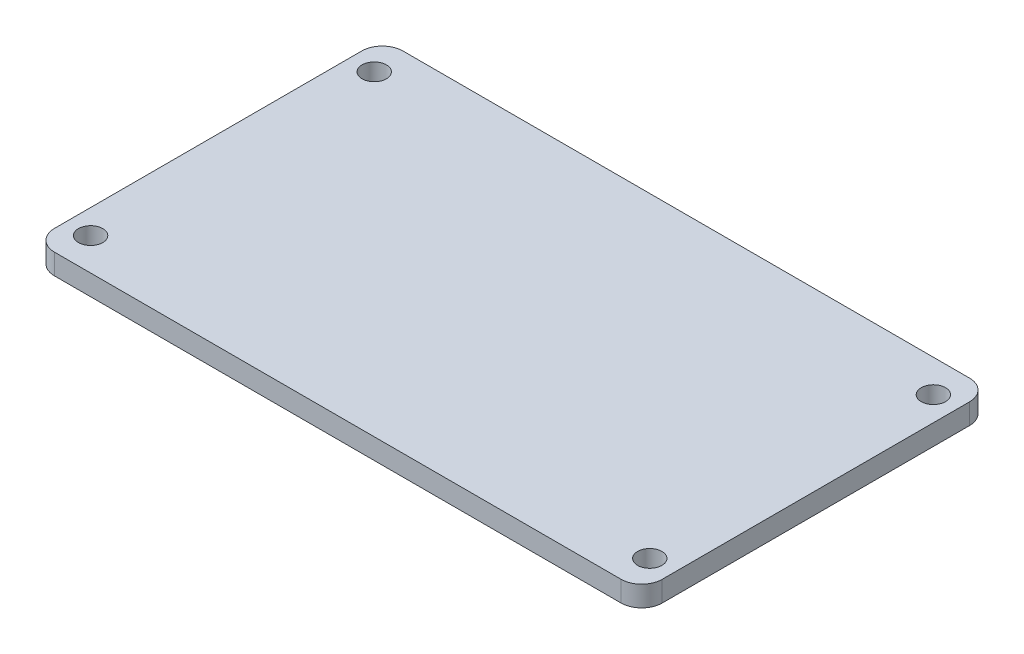
from build123d import *

# Parameters (mm, degrees)
SKETCH1_R           = 1.5
BOSS_EXTRUDE1_DEPTH = 2.54


with BuildPart() as part:
    # Sketch1 → Boss-Extrude1 (new body)
    with BuildSketch(Plane(origin=(0, 0, 0), x_dir=(1, 0, 0), z_dir=(0, 1, 0))):
        with BuildLine():
            Line((-34.96, -21.5), (34.96, -21.5))
            ThreePointArc((34.96, -21.5), (36.756051224, -20.756051224), (37.5, -18.96))
            Line((37.5, -18.96), (37.5, 18.96))
            ThreePointArc((37.5, 18.96), (36.756051224, 20.756051224), (34.96, 21.5))
            Line((34.96, 21.5), (-34.96, 21.5))
            ThreePointArc((-34.96, 21.5), (-36.756051224, 20.756051224), (-37.5, 18.96))
            Line((-37.5, 18.96), (-37.5, -18.96))
            ThreePointArc((-37.5, -18.96), (-36.756051224, -20.756051224), (-34.96, -21.5))
        make_face()
        with Locations((-34.5, 17.5)):
            Circle(SKETCH1_R, mode=Mode.SUBTRACT)
        with Locations((-34.5, -17.5)):
            Circle(SKETCH1_R, mode=Mode.SUBTRACT)
        with Locations((34.5, -17.5)):
            Circle(SKETCH1_R, mode=Mode.SUBTRACT)
        with Locations((34.5, 17.5)):
            Circle(SKETCH1_R, mode=Mode.SUBTRACT)
    extrude(amount=BOSS_EXTRUDE1_DEPTH)


solid = part.part
